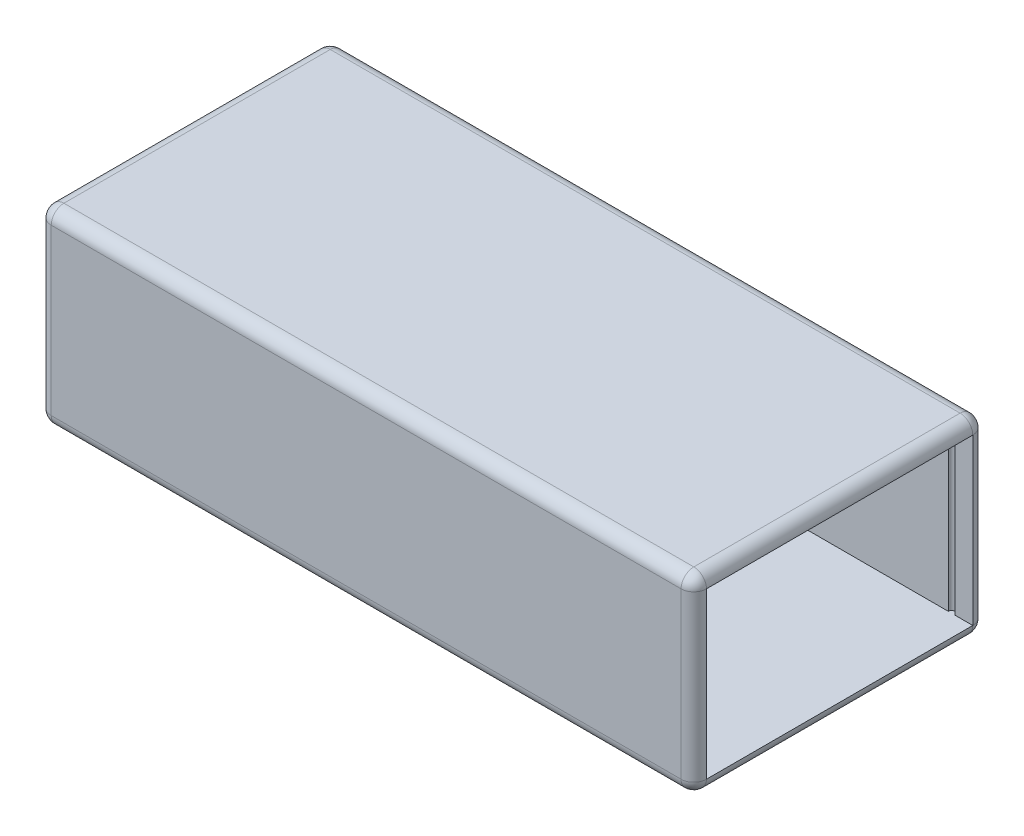
from build123d import *

# Parameters (mm, degrees)
ESBO_O1_W                = 155
ESBO_O1_H                = 69
RESSALTO_EXTRUS_O1_DEPTH = 42
ESBO_O2_W                = 153
ESBO_O2_H                = 63
CORTE_EXTRUS_O1_DEPTH    = 39
RESSALTO_EXTRUS_O3_START = -4.25
ESBO_O5_W                = 120.5
ESBO_O5_H                = 2
RESSALTO_EXTRUS_O3_DEPTH = 8.25
ESBO_O7_R                = 0.8
CORTE_EXTRUS_O4_DEPTH    = 39
ESBO_O10_R               = 0.75
RESSALTO_EXTRUS_O5_DEPTH = 4.25
ESBO_O9_W                = 155
ESBO_O9_H                = 69
RESSALTO_EXTRUS_O4_DEPTH = 3
FILETE6_R                = 3
FILETE7_R                = 3
ESBO_O11_W               = 18.1
ESBO_O11_H               = 15.1
RESSALTO_EXTRUS_O6_DEPTH = 5
ESBO_O12_W               = 15
ESBO_O12_H               = 11.5
CORTE_EXTRUS_O5_DEPTH    = 9
ESBO_O14_W               = 13.5
ESBO_O14_H               = 1.85
CORTE_EXTRUS_O6_DEPTH    = 180.961106909


with BuildPart() as part:
    # Esboço1 → Ressalto-extrusão1 (new body)
    with BuildSketch(Plane(origin=(0, 0, 0), x_dir=(1, 0, 0), z_dir=(0, 1, 0))):
        with Locations((77.5, 34.5)):
            Rectangle(ESBO_O1_W, ESBO_O1_H)
    extrude(amount=RESSALTO_EXTRUS_O1_DEPTH)

    # Esboço2 → Corte-extrusão1 (cut)
    with BuildSketch(Plane(origin=(0, 42, 0), x_dir=(1, 0, 0), z_dir=(0, 1, 0))):
        with Locations((78.5, 34.5)):
            Rectangle(ESBO_O2_W, ESBO_O2_H)
    extrude(amount=-CORTE_EXTRUS_O1_DEPTH, mode=Mode.SUBTRACT)

    # Esboço5 → Ressalto-extrusão3 (add)
    with BuildSketch(Plane(origin=(0, 42, 0), x_dir=(1, 0, 0), z_dir=(0, 1, 0)).offset(RESSALTO_EXTRUS_O3_START)):
        with Locations((62.25, 4)):
            Rectangle(ESBO_O5_W, ESBO_O5_H)
        with Locations((62.25, 65)):
            Rectangle(ESBO_O5_W, ESBO_O5_H)
    extrude(amount=-RESSALTO_EXTRUS_O3_DEPTH)

    # Esboço7 → Corte-extrusão4 (cut)
    with BuildSketch(Plane(origin=(0, 42, 0), x_dir=(1, 0, 0), z_dir=(0, 1, 0))):
        with Locations((150, 3)):
            Circle(ESBO_O7_R)
        with Locations((150, 66)):
            Circle(ESBO_O7_R)
    extrude(amount=-CORTE_EXTRUS_O4_DEPTH, mode=Mode.SUBTRACT)

    # Esboço10 → Ressalto-extrusão5 (add)
    with BuildSketch(Plane(origin=(0, 42, 0), x_dir=(1, 0, 0), z_dir=(0, 1, 0))):
        with Locations((7, 3)):
            Circle(ESBO_O10_R)
        with Locations((7, 66)):
            Circle(ESBO_O10_R)
    extrude(amount=-RESSALTO_EXTRUS_O5_DEPTH)

    # Filete6
    filete6_edges = [part.edges().sort_by_distance(p)[0] for p in [
        (0, 21, -69),
        (0, 0, -34.5),
        (0, 21, 0),
        (77.5, 0, 0),
        (155, 21, 0),
        (77.5, 0, -69),
        (155, 0, -34.5),
        (155, 21, -69),
    ]]
    fillet(filete6_edges, radius=FILETE6_R - 0.0001)  # a hair under: the kernel refuses the full size

    # Esboço11 → Ressalto-extrusão6 (add)
    with BuildSketch(Plane.ZY):
        with Locations((-53.3, 29.45)):
            Rectangle(ESBO_O11_W, ESBO_O11_H)
    extrude(amount=RESSALTO_EXTRUS_O6_DEPTH)

    # Esboço12 → Corte-extrusão5 (cut)
    with BuildSketch(Plane.ZY.offset(5)):
        with Locations((-53.3, 29.5)):
            Rectangle(ESBO_O12_W, ESBO_O12_H)
    extrude(amount=-CORTE_EXTRUS_O5_DEPTH, mode=Mode.SUBTRACT)

    # Esboço14 → Corte-extrusão6 (cut, through all)
    with BuildSketch(Plane.ZY.offset(5)):
        with Locations((-53.3, 22.825)):
            Rectangle(ESBO_O14_W, ESBO_O14_H)
    extrude(amount=-CORTE_EXTRUS_O6_DEPTH, mode=Mode.SUBTRACT)


with BuildPart() as body_2:
    # Esboço9 → Ressalto-extrusão4 (new body)
    with BuildSketch(Plane(origin=(0, 42, 0), x_dir=(1, 0, 0), z_dir=(0, 1, 0))):
        with Locations((77.5, 34.5)):
            Rectangle(ESBO_O9_W, ESBO_O9_H)
    extrude(amount=RESSALTO_EXTRUS_O4_DEPTH)

    # Filete7
    filete7_edges = [body_2.edges().sort_by_distance(p)[0] for p in [
        (0, 45, -34.5),
        (77.5, 45, 0),
        (155, 45, -34.5),
        (77.5, 45, -69),
        (155, 43.5, 0),
        (0, 43.5, 0),
        (0, 43.5, -69),
        (155, 43.5, -69),
    ]]
    fillet(filete7_edges, radius=FILETE7_R - 0.0001)  # a hair under: the kernel refuses the full size


solid = Compound([part.part, body_2.part])
